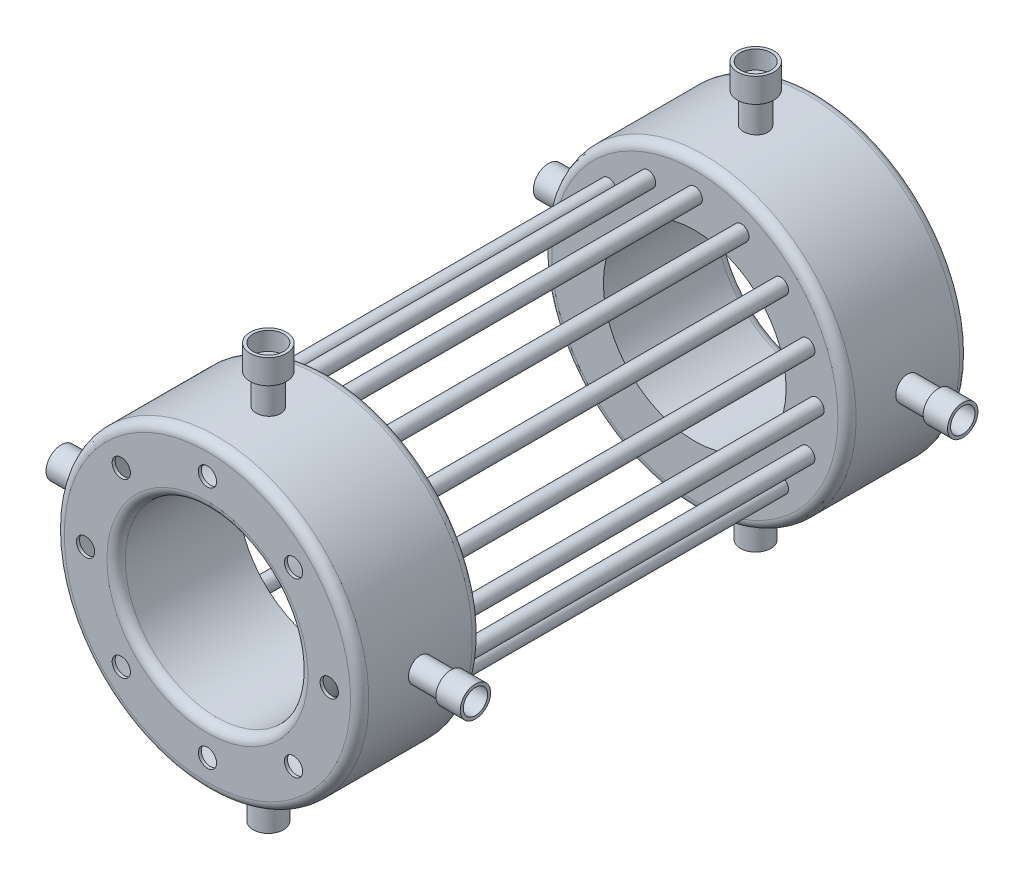
from build123d import *

# Parameters (mm, degrees)
SKETCH1_R                = 50
SKETCH1_R_2              = 30
BOSS_EXTRUDE1_DEPTH      = 40
SHELL7_T                 = -1
BOSS_EXTRUDE3_START      = -1
SKETCH3_R                = 49
SKETCH3_R_2              = 31
BOSS_EXTRUDE3_DEPTH      = 1
BOSS_EXTRUDE2_REACH      = 176.929
SKETCH2_R                = 2.5
SKETCH2_R_2              = 1.5
FILLET1_R                = 3
BOSS_EXTRUDE4_START      = 60
SKETCH4_R                = 6
SKETCH4_R_2              = 5
BOSS_EXTRUDE4_DEPTH      = 8
SKETCH5_R                = 5
BOSS_EXTRUDE5_DEPTH      = 2
BOSS_EXTRUDE6_REACH      = 235.666
BOSS_EXTRUDE6_END_RADIUS = 50
SKETCH6_R                = 4
CIRPATTERN7_COUNT        = 4
SKETCH8_R                = 4
BOSS_EXTRUDE7_DEPTH      = 2
BOSS_EXTRUDE8_START      = -2
SKETCH9_R                = 5
SKETCH9_R_2              = 4
BOSS_EXTRUDE8_DEPTH      = 8
SKETCH11_R               = 4
BOSS_EXTRUDE9_DEPTH      = 2
BOSS_EXTRUDE10_START     = -2
SKETCH12_R               = 5
SKETCH12_R_2             = 4
BOSS_EXTRUDE10_DEPTH     = 8
SKETCH13_R               = 4
BOSS_EXTRUDE11_DEPTH     = 2
BOSS_EXTRUDE12_START     = -2
SKETCH14_R               = 5
SKETCH14_R_2             = 4
BOSS_EXTRUDE12_DEPTH     = 8
MIRROR4_START            = 49.839743075
MIRROR4_OUTLINE_R        = 4
MIRROR4_DEPTH            = 12.160256925
MIRROR4_START_2          = -62
MIRROR4_2_OUTLINE_R      = 4
MIRROR4_2_DEPTH          = 12.160256872
MIRROR4_START_3          = -68
MIRROR4_3_OUTLINE_R      = 5
MIRROR4_3_OUTLINE_R_2    = 4
MIRROR4_3_DEPTH          = 8
MIRROR4_START_4          = 60
MIRROR4_4_OUTLINE_R      = 5
MIRROR4_4_OUTLINE_R_2    = 4
MIRROR4_4_DEPTH          = 8
MIRROR4_5_OUTLINE_R      = 4
MIRROR4_5_DEPTH          = 12.160256872
MIRROR4_START_5          = 49.839743128
MIRROR4_6_OUTLINE_R      = 4
MIRROR4_6_DEPTH          = 12.160256872
MIRROR4_7_OUTLINE_R      = 6
MIRROR4_7_OUTLINE_R_2    = 5
MIRROR4_7_DEPTH          = 8
MIRROR4_8_OUTLINE_R      = 5
MIRROR4_8_OUTLINE_R_2    = 4
MIRROR4_8_DEPTH          = 8
MIRROR4_9_OUTLINE_R      = 5
MIRROR4_9_OUTLINE_R_2    = 4
MIRROR4_9_DEPTH          = 2
SKETCH16_R               = 3
CUT_EXTRUDE1_DEPTH       = 1
SKETCH18_R               = 3
CUT_EXTRUDE2_DEPTH       = 1


# Read off the part's stored shape, not the designer's step: Mirror4
with BuildPart() as part:
    # Sketch1 → Boss-Extrude1 (new body)
    with BuildSketch(Plane.XY):
        Circle(SKETCH1_R)
        Circle(SKETCH1_R_2, mode=Mode.SUBTRACT)
    extrude(amount=BOSS_EXTRUDE1_DEPTH)

    # Shell7
    shell7_openings = [part.faces().sort_by_distance(p)[0] for p in [
        (-48.585786438, 0, 40),
    ]]
    offset(amount=SHELL7_T, openings=shell7_openings, kind=Kind.INTERSECTION)

    # Sketch3 → Boss-Extrude3 (add)
    with BuildSketch(Plane.XY.offset(40).offset(BOSS_EXTRUDE3_START)):
        Circle(SKETCH3_R)
        Circle(SKETCH3_R_2, mode=Mode.SUBTRACT)
    extrude(amount=BOSS_EXTRUDE3_DEPTH)


with BuildPart() as body_2:
    # Mirror3: mirrored copy
    add(part.part.mirror(Plane.XY.offset(100)))

    # Sketch2 → Boss-Extrude2 (add, up to next)
    with BuildSketch(Plane.XY.offset(40), mode=Mode.PRIVATE) as boss_extrude2_sk1:
        with Locations(Location((0, 40, 0), (0, 0, 180))):
            Circle(SKETCH2_R)
        with Locations(Location((0, 40, 0), (0, 0, 180))):
            Circle(SKETCH2_R_2, mode=Mode.SUBTRACT)
    boss_extrude2_tool1 = extrude(boss_extrude2_sk1.sketch, amount=BOSS_EXTRUDE2_REACH, mode=Mode.PRIVATE) - body_2.part
    # Sketch2 → Boss-Extrude2 (add, up to next)
    with BuildSketch(Plane.XY.offset(40), mode=Mode.PRIVATE) as boss_extrude2_sk2:
        with Locations(Location((15.307337295, 36.9551813, 0), (0, 0, 180))):
            Circle(SKETCH2_R)
        with Locations(Location((15.307337295, 36.9551813, 0), (0, 0, 180))):
            Circle(SKETCH2_R_2, mode=Mode.SUBTRACT)
    boss_extrude2_tool2 = extrude(boss_extrude2_sk2.sketch, amount=BOSS_EXTRUDE2_REACH, mode=Mode.PRIVATE) - body_2.part
    # Sketch2 → Boss-Extrude2 (add, up to next)
    with BuildSketch(Plane.XY.offset(40), mode=Mode.PRIVATE) as boss_extrude2_sk3:
        with Locations(Location((28.284271247, 28.284271247, 0), (0, 0, 180))):
            Circle(SKETCH2_R)
        with Locations(Location((28.284271247, 28.284271247, 0), (0, 0, 180))):
            Circle(SKETCH2_R_2, mode=Mode.SUBTRACT)
    boss_extrude2_tool3 = extrude(boss_extrude2_sk3.sketch, amount=BOSS_EXTRUDE2_REACH, mode=Mode.PRIVATE) - body_2.part
    # Sketch2 → Boss-Extrude2 (add, up to next)
    with BuildSketch(Plane.XY.offset(40), mode=Mode.PRIVATE) as boss_extrude2_sk4:
        with Locations(Location((36.9551813, 15.307337295, 0), (0, 0, 180))):
            Circle(SKETCH2_R)
        with Locations(Location((36.9551813, 15.307337295, 0), (0, 0, 180))):
            Circle(SKETCH2_R_2, mode=Mode.SUBTRACT)
    boss_extrude2_tool4 = extrude(boss_extrude2_sk4.sketch, amount=BOSS_EXTRUDE2_REACH, mode=Mode.PRIVATE) - body_2.part
    # Sketch2 → Boss-Extrude2 (add, up to next)
    with BuildSketch(Plane.XY.offset(40), mode=Mode.PRIVATE) as boss_extrude2_sk5:
        with Locations(Location((40, 0, 0), (0, 0, 180))):
            Circle(SKETCH2_R)
        with Locations(Location((40, 0, 0), (0, 0, 180))):
            Circle(SKETCH2_R_2, mode=Mode.SUBTRACT)
    boss_extrude2_tool5 = extrude(boss_extrude2_sk5.sketch, amount=BOSS_EXTRUDE2_REACH, mode=Mode.PRIVATE) - body_2.part
    # Sketch2 → Boss-Extrude2 (add, up to next)
    with BuildSketch(Plane.XY.offset(40), mode=Mode.PRIVATE) as boss_extrude2_sk6:
        with Locations(Location((36.9551813, -15.307337295, 0), (0, 0, 180))):
            Circle(SKETCH2_R)
        with Locations(Location((36.9551813, -15.307337295, 0), (0, 0, 180))):
            Circle(SKETCH2_R_2, mode=Mode.SUBTRACT)
    boss_extrude2_tool6 = extrude(boss_extrude2_sk6.sketch, amount=BOSS_EXTRUDE2_REACH, mode=Mode.PRIVATE) - body_2.part
    # Sketch2 → Boss-Extrude2 (add, up to next)
    with BuildSketch(Plane.XY.offset(40), mode=Mode.PRIVATE) as boss_extrude2_sk7:
        with Locations(Location((28.284271247, -28.284271247, 0), (0, 0, 180))):
            Circle(SKETCH2_R)
        with Locations(Location((28.284271247, -28.284271247, 0), (0, 0, 180))):
            Circle(SKETCH2_R_2, mode=Mode.SUBTRACT)
    boss_extrude2_tool7 = extrude(boss_extrude2_sk7.sketch, amount=BOSS_EXTRUDE2_REACH, mode=Mode.PRIVATE) - body_2.part
    # Sketch2 → Boss-Extrude2 (add, up to next)
    with BuildSketch(Plane.XY.offset(40), mode=Mode.PRIVATE) as boss_extrude2_sk8:
        with Locations(Location((15.307337295, -36.9551813, 0), (0, 0, 180))):
            Circle(SKETCH2_R)
        with Locations(Location((15.307337295, -36.9551813, 0), (0, 0, 180))):
            Circle(SKETCH2_R_2, mode=Mode.SUBTRACT)
    boss_extrude2_tool8 = extrude(boss_extrude2_sk8.sketch, amount=BOSS_EXTRUDE2_REACH, mode=Mode.PRIVATE) - body_2.part
    # Sketch2 → Boss-Extrude2 (add, up to next)
    with BuildSketch(Plane.XY.offset(40), mode=Mode.PRIVATE) as boss_extrude2_sk9:
        with Locations(Location((0, -40, 0), (0, 0, 180))):
            Circle(SKETCH2_R)
        with Locations(Location((0, -40, 0), (0, 0, 180))):
            Circle(SKETCH2_R_2, mode=Mode.SUBTRACT)
    boss_extrude2_tool9 = extrude(boss_extrude2_sk9.sketch, amount=BOSS_EXTRUDE2_REACH, mode=Mode.PRIVATE) - body_2.part
    # Sketch2 → Boss-Extrude2 (add, up to next)
    with BuildSketch(Plane.XY.offset(40), mode=Mode.PRIVATE) as boss_extrude2_sk10:
        with Locations(Location((-15.307337295, -36.9551813, 0), (0, 0, 180))):
            Circle(SKETCH2_R)
        with Locations(Location((-15.307337295, -36.9551813, 0), (0, 0, 180))):
            Circle(SKETCH2_R_2, mode=Mode.SUBTRACT)
    boss_extrude2_tool10 = extrude(boss_extrude2_sk10.sketch, amount=BOSS_EXTRUDE2_REACH, mode=Mode.PRIVATE) - body_2.part
    # Sketch2 → Boss-Extrude2 (add, up to next)
    with BuildSketch(Plane.XY.offset(40), mode=Mode.PRIVATE) as boss_extrude2_sk11:
        with Locations(Location((-28.284271247, -28.284271247, 0), (0, 0, 180))):
            Circle(SKETCH2_R)
        with Locations(Location((-28.284271247, -28.284271247, 0), (0, 0, 180))):
            Circle(SKETCH2_R_2, mode=Mode.SUBTRACT)
    boss_extrude2_tool11 = extrude(boss_extrude2_sk11.sketch, amount=BOSS_EXTRUDE2_REACH, mode=Mode.PRIVATE) - body_2.part
    # Sketch2 → Boss-Extrude2 (add, up to next)
    with BuildSketch(Plane.XY.offset(40), mode=Mode.PRIVATE) as boss_extrude2_sk12:
        with Locations(Location((-36.9551813, -15.307337295, 0), (0, 0, 180))):
            Circle(SKETCH2_R)
        with Locations(Location((-36.9551813, -15.307337295, 0), (0, 0, 180))):
            Circle(SKETCH2_R_2, mode=Mode.SUBTRACT)
    boss_extrude2_tool12 = extrude(boss_extrude2_sk12.sketch, amount=BOSS_EXTRUDE2_REACH, mode=Mode.PRIVATE) - body_2.part
    # Sketch2 → Boss-Extrude2 (add, up to next)
    with BuildSketch(Plane.XY.offset(40), mode=Mode.PRIVATE) as boss_extrude2_sk13:
        with Locations(Location((-40, 0, 0), (0, 0, 180))):
            Circle(SKETCH2_R)
        with Locations(Location((-40, 0, 0), (0, 0, 180))):
            Circle(SKETCH2_R_2, mode=Mode.SUBTRACT)
    boss_extrude2_tool13 = extrude(boss_extrude2_sk13.sketch, amount=BOSS_EXTRUDE2_REACH, mode=Mode.PRIVATE) - body_2.part
    # Sketch2 → Boss-Extrude2 (add, up to next)
    with BuildSketch(Plane.XY.offset(40), mode=Mode.PRIVATE) as boss_extrude2_sk14:
        with Locations(Location((-36.9551813, 15.307337295, 0), (0, 0, 180))):
            Circle(SKETCH2_R)
        with Locations(Location((-36.9551813, 15.307337295, 0), (0, 0, 180))):
            Circle(SKETCH2_R_2, mode=Mode.SUBTRACT)
    boss_extrude2_tool14 = extrude(boss_extrude2_sk14.sketch, amount=BOSS_EXTRUDE2_REACH, mode=Mode.PRIVATE) - body_2.part
    # Sketch2 → Boss-Extrude2 (add, up to next)
    with BuildSketch(Plane.XY.offset(40), mode=Mode.PRIVATE) as boss_extrude2_sk15:
        with Locations(Location((-28.284271247, 28.284271247, 0), (0, 0, 180))):
            Circle(SKETCH2_R)
        with Locations(Location((-28.284271247, 28.284271247, 0), (0, 0, 180))):
            Circle(SKETCH2_R_2, mode=Mode.SUBTRACT)
    boss_extrude2_tool15 = extrude(boss_extrude2_sk15.sketch, amount=BOSS_EXTRUDE2_REACH, mode=Mode.PRIVATE) - body_2.part
    # Sketch2 → Boss-Extrude2 (add, up to next)
    with BuildSketch(Plane.XY.offset(40), mode=Mode.PRIVATE) as boss_extrude2_sk16:
        with Locations(Location((-15.307337295, 36.9551813, 0), (0, 0, 180))):
            Circle(SKETCH2_R)
        with Locations(Location((-15.307337295, 36.9551813, 0), (0, 0, 180))):
            Circle(SKETCH2_R_2, mode=Mode.SUBTRACT)
    boss_extrude2_tool16 = extrude(boss_extrude2_sk16.sketch, amount=BOSS_EXTRUDE2_REACH, mode=Mode.PRIVATE) - body_2.part

    add(part.part)  # Boss-Extrude2 merges part
    add(boss_extrude2_tool1.solids().sort_by_distance((2.429289, 40, 40))[0])
    add(boss_extrude2_tool2.solids().sort_by_distance((17.736627, 36.955181, 40))[0])
    add(boss_extrude2_tool3.solids().sort_by_distance((30.713561, 28.284271, 40))[0])
    add(boss_extrude2_tool4.solids().sort_by_distance((39.384471, 15.307337, 40))[0])
    add(boss_extrude2_tool5.solids().sort_by_distance((42.429289, 0, 40))[0])
    add(boss_extrude2_tool6.solids().sort_by_distance((39.384471, -15.307337, 40))[0])
    add(boss_extrude2_tool7.solids().sort_by_distance((30.713561, -28.284271, 40))[0])
    add(boss_extrude2_tool8.solids().sort_by_distance((17.736627, -36.955181, 40))[0])
    add(boss_extrude2_tool9.solids().sort_by_distance((2.429289, -40, 40))[0])
    add(boss_extrude2_tool10.solids().sort_by_distance((-12.878048, -36.955181, 40))[0])
    add(boss_extrude2_tool11.solids().sort_by_distance((-25.854982, -28.284271, 40))[0])
    add(boss_extrude2_tool12.solids().sort_by_distance((-34.525892, -15.307337, 40))[0])
    add(boss_extrude2_tool13.solids().sort_by_distance((-37.570711, 0, 40))[0])
    add(boss_extrude2_tool14.solids().sort_by_distance((-34.525892, 15.307337, 40))[0])
    add(boss_extrude2_tool15.solids().sort_by_distance((-25.854982, 28.284271, 40))[0])
    add(boss_extrude2_tool16.solids().sort_by_distance((-12.878048, 36.955181, 40))[0])

    # Fillet1
    fillet1_edges = [body_2.edges().sort_by_distance(p)[0] for p in [
        (-50, 0, 0),
        (-50, 0, 200),
        (-50, 0, 160),
        (-30, 0, 200),
        (-50, 0, 40),
        (-30, 0, 0),
    ]]
    fillet(fillet1_edges, radius=FILLET1_R)



with BuildPart() as body_2_2:
    # Sketch4 → Boss-Extrude4 (new body)
    with BuildSketch(Plane(origin=(0, 0, 0), x_dir=(1, 0, 0), z_dir=(0, 1, 0)).offset(BOSS_EXTRUDE4_START)):
        with Locations(Location((0, -180, 0), (0, 0, 270))):
            Circle(SKETCH4_R)
        with Locations(Location((0, -180, 0), (0, 0, 270))):
            Circle(SKETCH4_R_2, mode=Mode.SUBTRACT)
    extrude(amount=BOSS_EXTRUDE4_DEPTH)

    # Sketch5 → Boss-Extrude5 (add)
    with BuildSketch(Plane.XZ.offset(-60)):
        with Locations(Location((0, 180, 0), (0, 0, 270))):
            Circle(SKETCH5_R)
    extrude(amount=-BOSS_EXTRUDE5_DEPTH)


with BuildPart() as body_2_1:
    add(body_2.part)

    add(body_2_2.part)  # Boss-Extrude6 merges body 2 2
    # Boss-Extrude6: up to this cylinder (the profile starts outside it)
    boss_extrude6_end = Plane(origin=(0, 0, 180), z_dir=(0, 0, 1)) * Cylinder(BOSS_EXTRUDE6_END_RADIUS, 572.332, mode=Mode.PRIVATE)
    # Sketch6 → Boss-Extrude6 (add, up to the surface)
    with BuildSketch(Plane.XZ.offset(-60), mode=Mode.PRIVATE) as boss_extrude6_sk1:
        with Locations(Location((0, 180, 0), (0, 0, 90))):
            Circle(SKETCH6_R)
    boss_extrude6_tool1 = extrude(boss_extrude6_sk1.sketch, amount=BOSS_EXTRUDE6_REACH, mode=Mode.PRIVATE) - boss_extrude6_end
    boss_extrude6 = boss_extrude6_tool1.solids().sort_by_distance((0, 60, 180))[0]
    add(boss_extrude6)

    # CirPattern7: Boss-Extrude6 ×4 about axis
    cirpattern7_axis = Axis((0, 0, 160), (0, 0, 1))
    for i in range(1, CIRPATTERN7_COUNT):
        add(boss_extrude6.rotate(cirpattern7_axis, i * 360 / CIRPATTERN7_COUNT))

    # Sketch8 → Boss-Extrude7 (add)
    with BuildSketch(Plane(origin=(60, 0, 0), x_dir=(0, 0, -1), z_dir=(1, 0, 0))):
        with Locations((-180, 0)):
            Circle(SKETCH8_R)
    extrude(amount=BOSS_EXTRUDE7_DEPTH)

    # Sketch11 → Boss-Extrude9 (add)
    with BuildSketch(Plane.ZY.offset(60)):
        with Locations(Location((180, 0, 0), (0, 0, 90))):
            Circle(SKETCH11_R)
    extrude(amount=BOSS_EXTRUDE9_DEPTH)

    # Sketch12 → Boss-Extrude10 (add)
    with BuildSketch(Plane.ZY.offset(62).offset(BOSS_EXTRUDE10_START)):
        with Locations(Location((180, 0, 0), (0, 0, 90))):
            Circle(SKETCH12_R)
        with Locations(Location((180, 0, 0), (0, 0, 90))):
            Circle(SKETCH12_R_2, mode=Mode.SUBTRACT)
    extrude(amount=BOSS_EXTRUDE10_DEPTH)

    # Sketch13 → Boss-Extrude11 (add)
    with BuildSketch(Plane.XZ.offset(60)):
        with Locations(Location((0, 180, 0), (0, 0, 90))):
            Circle(SKETCH13_R)
    extrude(amount=BOSS_EXTRUDE11_DEPTH)

    # Sketch14 → Boss-Extrude12 (add)
    with BuildSketch(Plane.XZ.offset(62).offset(BOSS_EXTRUDE12_START)):
        with Locations(Location((0, 180, 0), (0, 0, 270))):
            Circle(SKETCH14_R)
        with Locations(Location((0, 180, 0), (0, 0, 270))):
            Circle(SKETCH14_R_2, mode=Mode.SUBTRACT)
    extrude(amount=BOSS_EXTRUDE12_DEPTH)

    # Mirror4 outline → Mirror4 (add)
    with BuildSketch(Plane.YZ.offset(MIRROR4_START)):
        with Locations((0, 20)):
            Circle(MIRROR4_OUTLINE_R)
    extrude(amount=MIRROR4_DEPTH)

    # Mirror4 2 outline → Mirror4 2 (add)
    with BuildSketch(Plane.YZ.offset(MIRROR4_START_2)):
        with Locations((0, 20)):
            Circle(MIRROR4_2_OUTLINE_R)
    extrude(amount=MIRROR4_2_DEPTH)

    # Mirror4 3 outline → Mirror4 3 (add)
    with BuildSketch(Plane.YZ.offset(MIRROR4_START_3)):
        with Locations((0, 20)):
            Circle(MIRROR4_3_OUTLINE_R)
        with Locations((0, 20)):
            Circle(MIRROR4_3_OUTLINE_R_2, mode=Mode.SUBTRACT)
    extrude(amount=MIRROR4_3_DEPTH)

    # Mirror4 4 outline → Mirror4 4 (add)
    with BuildSketch(Plane.YZ.offset(MIRROR4_START_4)):
        with Locations((0, 20)):
            Circle(MIRROR4_4_OUTLINE_R)
        with Locations((0, 20)):
            Circle(MIRROR4_4_OUTLINE_R_2, mode=Mode.SUBTRACT)
    extrude(amount=MIRROR4_4_DEPTH)

    # Mirror4 5 outline → Mirror4 5 (add)
    with BuildSketch(Plane(origin=(0, 0, 0), x_dir=(1, 0, 0), z_dir=(0, 1, 0)).offset(MIRROR4_START_2)):
        with Locations((0, -20)):
            Circle(MIRROR4_5_OUTLINE_R)
    extrude(amount=MIRROR4_5_DEPTH)

    # Mirror4 6 outline → Mirror4 6 (add)
    with BuildSketch(Plane(origin=(0, 0, 0), x_dir=(1, 0, 0), z_dir=(0, 1, 0)).offset(MIRROR4_START_5)):
        with Locations((0, -20)):
            Circle(MIRROR4_6_OUTLINE_R)
    extrude(amount=MIRROR4_6_DEPTH)

    # Mirror4 8 outline → Mirror4 8 (add)
    with BuildSketch(Plane(origin=(0, 0, 0), x_dir=(1, 0, 0), z_dir=(0, 1, 0)).offset(MIRROR4_START_3)):
        with Locations((0, -20)):
            Circle(MIRROR4_8_OUTLINE_R)
        with Locations((0, -20)):
            Circle(MIRROR4_8_OUTLINE_R_2, mode=Mode.SUBTRACT)
    extrude(amount=MIRROR4_8_DEPTH)



with BuildPart() as body_2_3:
    # Sketch9 → Boss-Extrude8 (new body)
    with BuildSketch(Plane(origin=(62, 0, 0), x_dir=(0, 0, -1), z_dir=(1, 0, 0)).offset(BOSS_EXTRUDE8_START)):
        with Locations(Location((-180, 0, 0), (0, 0, 90))):
            Circle(SKETCH9_R)
        with Locations(Location((-180, 0, 0), (0, 0, 90))):
            Circle(SKETCH9_R_2, mode=Mode.SUBTRACT)
    extrude(amount=BOSS_EXTRUDE8_DEPTH)


with BuildPart() as body_3:
    # Mirror4 7 outline → Mirror4 7 (new body)
    with BuildSketch(Plane(origin=(0, 0, 0), x_dir=(1, 0, 0), z_dir=(0, 1, 0)).offset(MIRROR4_START_4)):
        with Locations((0, -20)):
            Circle(MIRROR4_7_OUTLINE_R)
        with Locations((0, -20)):
            Circle(MIRROR4_7_OUTLINE_R_2, mode=Mode.SUBTRACT)
    extrude(amount=MIRROR4_7_DEPTH)


with BuildPart() as body_2_4:
    add(body_2_1.part)

    add(body_3.part)  # Mirror4 9 merges body 3
    # Mirror4 9 outline → Mirror4 9 (add)
    with BuildSketch(Plane(origin=(0, 0, 0), x_dir=(1, 0, 0), z_dir=(0, 1, 0)).offset(MIRROR4_START_4)):
        with Locations((0, -20)):
            Circle(MIRROR4_9_OUTLINE_R)
        with Locations((0, -20)):
            Circle(MIRROR4_9_OUTLINE_R_2, mode=Mode.SUBTRACT)
    extrude(amount=MIRROR4_9_DEPTH)

    # Sketch16 → Cut-Extrude1 (cut)
    with BuildSketch(Plane.XY.offset(200)):
        with Locations((0, 40)):
            Circle(SKETCH16_R)
        with Locations((40, 0)):
            Circle(SKETCH16_R)
        with Locations((0, -40)):
            Circle(SKETCH16_R)
        with Locations((-40, 0)):
            Circle(SKETCH16_R)
    extrude(amount=-CUT_EXTRUDE1_DEPTH, mode=Mode.SUBTRACT)

    # Sketch18 → Cut-Extrude2 (cut)
    with BuildSketch(Plane.XY.offset(200)):
        with Locations((28.284271247, 28.284271247)):
            Circle(SKETCH18_R)
        with Locations((28.284271247, -28.284271247)):
            Circle(SKETCH18_R)
        with Locations((-28.284271247, -28.284271247)):
            Circle(SKETCH18_R)
        with Locations((-28.284271247, 28.284271247)):
            Circle(SKETCH18_R)
    extrude(amount=-CUT_EXTRUDE2_DEPTH, mode=Mode.SUBTRACT)


solid = Compound([body_2_3.part, body_2_4.part])
